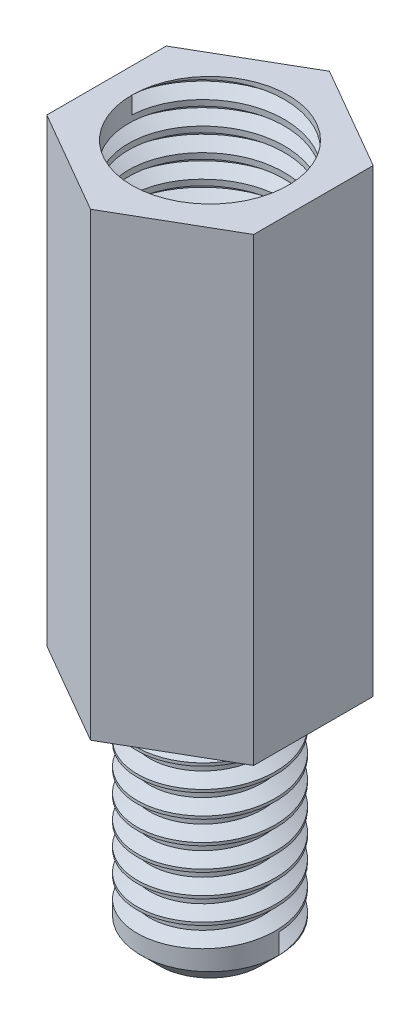
from build123d import *

# Parameters (mm, degrees)
BOSS_EXTRUDE1_DEPTH      = 10
M3_CLEARANCE_HOLE1_D     = 3.4
M3_CLEARANCE_HOLE1_DEPTH = 6
M3_CLEARANCE_HOLE1_TIP   = 1.021463052
THREAD1_PITCH            = 0.5
SKETCH10_R               = 1.5
BOSS_EXTRUDE2_DEPTH      = 5
CHAMFER1_SIZE            = 0.4
THREAD3_PITCH            = 0.5


with BuildPart() as part:
    # Sketch2 → Boss-Extrude1 (new body)
    with BuildSketch(Plane(origin=(0, 0, 0), x_dir=(1, 0, 0), z_dir=(0, 1, 0))):
        Polygon((0, 2.598076211), (-2.25, 1.299038106), (-2.25, -1.299038106), (0, -2.598076211), (2.25, -1.299038106), (2.25, 1.299038106), align=None)
    extrude(amount=BOSS_EXTRUDE1_DEPTH)

    # M3 Clearance Hole1
    with Locations(Plane(origin=(0, 10, 0), x_dir=(1, 0, 0), z_dir=(0, 1, 0))):
        with Locations((0, 0)):
            Hole(M3_CLEARANCE_HOLE1_D / 2, depth=M3_CLEARANCE_HOLE1_DEPTH)
            with Locations((0, 0, -(M3_CLEARANCE_HOLE1_DEPTH + M3_CLEARANCE_HOLE1_TIP / 2))):  # 118° drill point
                Cone(0, M3_CLEARANCE_HOLE1_D / 2, M3_CLEARANCE_HOLE1_TIP, mode=Mode.SUBTRACT)

    # Thread1: the profile of Thread Profile1 profile screwed along a right-hand helix of 8 turns, 6 arcs to a turn; built about Z, then put on its axis
    thread1_z = Axis((0, 0, 0), (0, 0, 1))
    thread1_corners = [(1.6997, 0, -0.000173205), (1.970632937, 0, 0.156249999), (1.970632937, 0, 0.218749999), (1.6997, 0, 0.375173204)]
    with BuildLine(mode=Mode.PRIVATE) as thread1_profile:
        Line(thread1_corners[0], thread1_corners[1])
        Line(thread1_corners[1], thread1_corners[2])
        Line(thread1_corners[2], thread1_corners[3])
        Line(thread1_corners[3], thread1_corners[0])
    thread1_cap = Face(thread1_profile.wire())
    thread1_turn_angles = [0, 30, 60, 90, 120, 150, 180, 210, 240, 270, 300, 330, 360]
    thread1_turn_weights = [1, 0.8660254037844387, 1, 0.8660254037844387, 1, 0.8660254037844387, 1, 0.8660254037844387, 1, 0.8660254037844387, 1, 0.8660254037844387, 1]
    thread1_turn_rails = [Edge.make_bspline([Vector(p[0], p[1], 0).rotate(thread1_z, thread1_turn_angles[k]) / thread1_turn_weights[k] + Vector(0, 0, p[2] + THREAD1_PITCH * thread1_turn_angles[k] / 360) for k in range(13)], [0, 0, 0, 1, 1, 2, 2, 3, 3, 4, 4, 5, 5, 6, 6, 6], 2, thread1_turn_weights) for p in thread1_corners]
    thread1_turn_sides = [Face.make_surface_from_curves(thread1_turn_rails[p[0]], thread1_turn_rails[p[1]]) for p in [(0, 1), (1, 2), (2, 3), (3, 0)]]
    thread1 = Plane(origin=(0, 10, 0), x_dir=(-1, 0, 0), z_dir=(0, -1, 0)) * Solid(Shell([*[p.moved(Location((0, 0, THREAD1_PITCH * i))) for i in range(8) for p in thread1_turn_sides], thread1_cap, thread1_cap.rotate(thread1_z, 2880).moved(Location((0, 0, THREAD1_PITCH * 2880 / 360)))]))
    add(thread1, mode=Mode.SUBTRACT)

    # Sketch10 → Boss-Extrude2 (add)
    with BuildSketch(Plane.XZ):
        with Locations(Location((0, 0, 0), (0, 0, 90))):
            Circle(SKETCH10_R)
    extrude(amount=BOSS_EXTRUDE2_DEPTH)

    # Chamfer1
    chamfer1_edges = [part.edges().sort_by_distance(p)[0] for p in [
        (0, -5, -1.5),
    ]]
    chamfer(chamfer1_edges, length=CHAMFER1_SIZE)

    # Thread3: the profile of Thread Profile3 profile screwed along a right-hand helix of 9.2 turns, 6 arcs to a turn; built about Z, then put on its axis
    thread3_z = Axis((0, 0, 0), (0, 0, 1))
    thread3_corners = [(1.5003, 0, -0.000173205), (1.5003, 0, 0.437673204), (1.229367063, 0, 0.281249999), (1.229367063, 0, 0.156249999)]
    with BuildLine(mode=Mode.PRIVATE) as thread3_profile:
        Line(thread3_corners[0], thread3_corners[1])
        Line(thread3_corners[1], thread3_corners[2])
        Line(thread3_corners[2], thread3_corners[3])
        Line(thread3_corners[3], thread3_corners[0])
    thread3_cap = Face(thread3_profile.wire())
    thread3_turn_angles = [0, 30, 60, 90, 120, 150, 180, 210, 240, 270, 300, 330, 360]
    thread3_turn_weights = [1, 0.8660254037844387, 1, 0.8660254037844387, 1, 0.8660254037844387, 1, 0.8660254037844387, 1, 0.8660254037844387, 1, 0.8660254037844387, 1]
    thread3_turn_rails = [Edge.make_bspline([Vector(p[0], p[1], 0).rotate(thread3_z, thread3_turn_angles[k]) / thread3_turn_weights[k] + Vector(0, 0, p[2] + THREAD3_PITCH * thread3_turn_angles[k] / 360) for k in range(13)], [0, 0, 0, 1, 1, 2, 2, 3, 3, 4, 4, 5, 5, 6, 6, 6], 2, thread3_turn_weights) for p in thread3_corners]
    thread3_turn_sides = [Face.make_surface_from_curves(thread3_turn_rails[p[0]], thread3_turn_rails[p[1]]) for p in [(0, 1), (1, 2), (2, 3), (3, 0)]]
    thread3_last_angles = [3240, 3270, 3300, 3306, 3312]
    thread3_last_weights = [1, 0.8660254037844387, 1, 0.9945218953682737, 1]
    thread3_last_rails = [Edge.make_bspline([Vector(p[0], p[1], 0).rotate(thread3_z, thread3_last_angles[k]) / thread3_last_weights[k] + Vector(0, 0, p[2] + THREAD3_PITCH * thread3_last_angles[k] / 360) for k in range(5)], [0, 0, 0, 1, 1, 2, 2, 2], 2, thread3_last_weights) for p in thread3_corners]
    thread3_last_sides = [Face.make_surface_from_curves(thread3_last_rails[p[0]], thread3_last_rails[p[1]]) for p in [(0, 1), (1, 2), (2, 3), (3, 0)]]
    thread3 = Plane(origin=(0, -4.6, 0), x_dir=(1, 0, 0), z_dir=(0, 1, 0)) * Solid(Shell([*[p.moved(Location((0, 0, THREAD3_PITCH * i))) for i in range(9) for p in thread3_turn_sides], *thread3_last_sides, thread3_cap, thread3_cap.rotate(thread3_z, 3312).moved(Location((0, 0, THREAD3_PITCH * 3312 / 360)))]))
    add(thread3, mode=Mode.SUBTRACT)


solid = part.part
